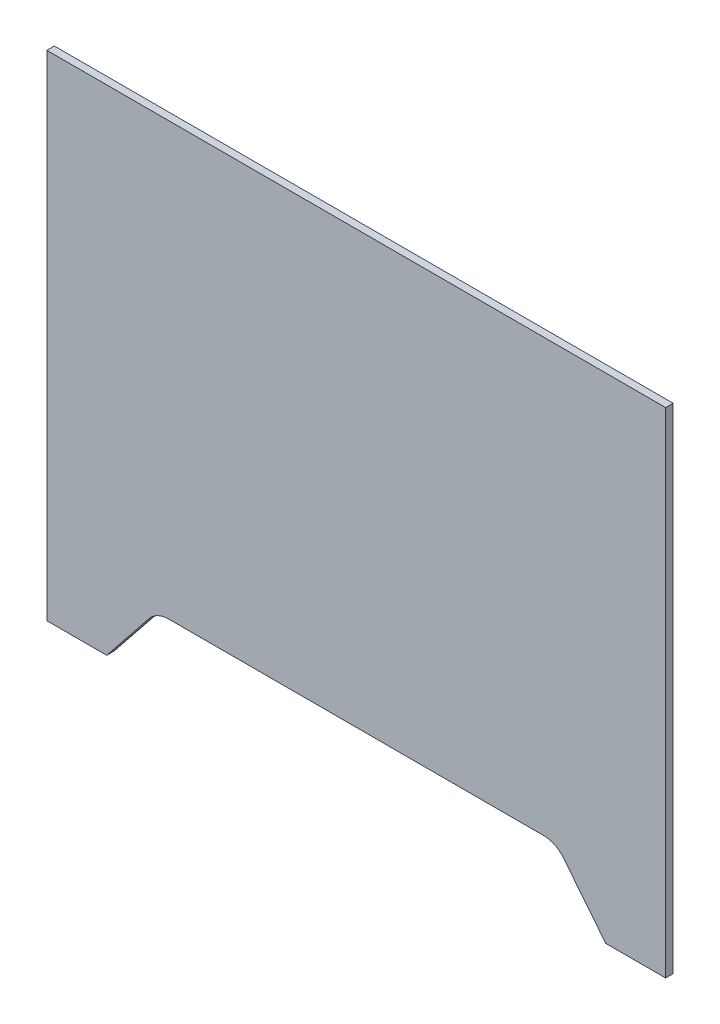
from build123d import *

# Parameters (mm, degrees)
BOSS_EXTRUDE1_DEPTH = 3


with BuildPart() as part:
    # Sketch1 → Boss-Extrude1 (new body)
    with BuildSketch(Plane.XY):
        with BuildLine():
            Line((-124, -99), (-124, 99))
            Line((-124, 99), (124, 99))
            Line((124, 99), (124, -99))
            Line((124, -99), (100, -99))
            Line((100, -99), (83.00243962, -77.753049524))
            ThreePointArc((83.00243962, -77.753049524), (79.52563883, -74.986967637), (75.193751525, -74))
            Line((75.193751525, -74), (-75.193751525, -74))
            ThreePointArc((-75.193751525, -74), (-79.52563883, -74.986967637), (-83.00243962, -77.753049524))
            Line((-83.00243962, -77.753049524), (-100, -99))
            Line((-100, -99), (-124, -99))
        make_face()
    extrude(amount=BOSS_EXTRUDE1_DEPTH)


solid = part.part
